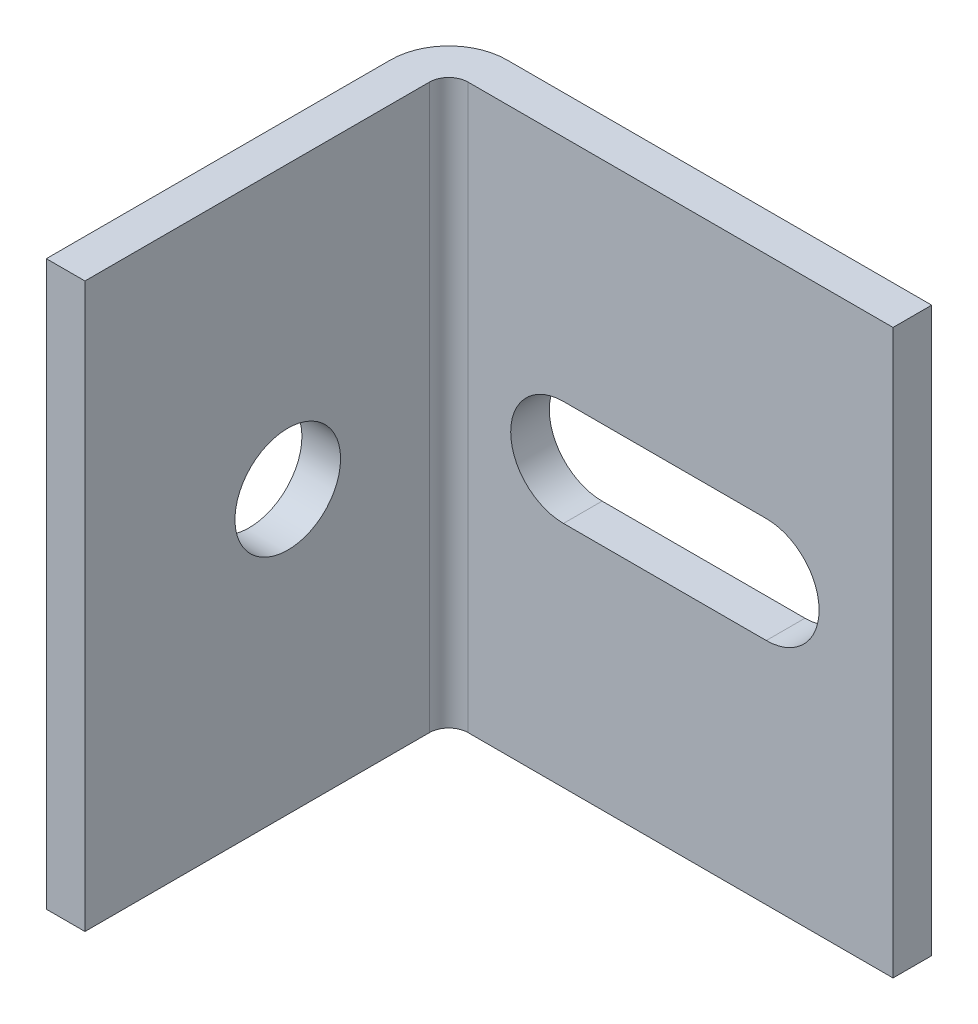
from build123d import *

# Parameters (mm, degrees)
EXTRUDE_THIN1_START = -11.1125
EXTRUDE_THIN1_DEPTH = 22.225
SKETCH4_R           = 2.0828
EXTRUDE3_DEPTH      = 27.127838741
CUT_EXTRUDE1_DEPTH  = 28.173622895


# Read off the part's stored shape, not the designer's step: Extrude-Thin1
with BuildPart() as part:
    # Extrude-Thin1 outline → Extrude-Thin1 (new body)
    with BuildSketch(Plane(origin=(0, 0, 0), x_dir=(1, 0, 0), z_dir=(0, 1, 0)).offset(EXTRUDE_THIN1_START)):
        with BuildLine():
            Line((2.286, -1.524), (19.05, -1.524))
            Line((19.05, -1.524), (19.05, 0))
            Line((19.05, 0), (2.286, 0))
            ThreePointArc((2.286, 0), (0.669553898, -0.669553898), (0, -2.286))
            Line((0, -2.286), (0, -15.875))
            Line((0, -15.875), (1.524, -15.875))
            Line((1.524, -15.875), (1.524, -2.286))
            ThreePointArc((1.524, -2.286), (1.747184633, -1.747184633), (2.286, -1.524))
        make_face()
    extrude(amount=EXTRUDE_THIN1_DEPTH)

    # Sketch4 → Extrude3 (cut, through all)
    with BuildSketch(Plane(origin=(1.524, 0, 0), x_dir=(0, 0, -1), z_dir=(1, 0, 0))):
        with Locations((-7.875, 0)):
            Circle(SKETCH4_R)
    extrude(amount=-EXTRUDE3_DEPTH, mode=Mode.SUBTRACT)

    # Sketch6 → Cut-Extrude1 (cut, through all)
    with BuildSketch(Plane.XY):
        with BuildLine():
            Line((6.05, 2.0828), (14.05, 2.0828))
            ThreePointArc((14.05, 2.0828), (16.1328, 0), (14.05, -2.0828))
            Line((14.05, -2.0828), (6.05, -2.0828))
            ThreePointArc((6.05, -2.0828), (3.9672, 0), (6.05, 2.0828))
        make_face()
    extrude(amount=CUT_EXTRUDE1_DEPTH, mode=Mode.SUBTRACT)


solid = part.part
